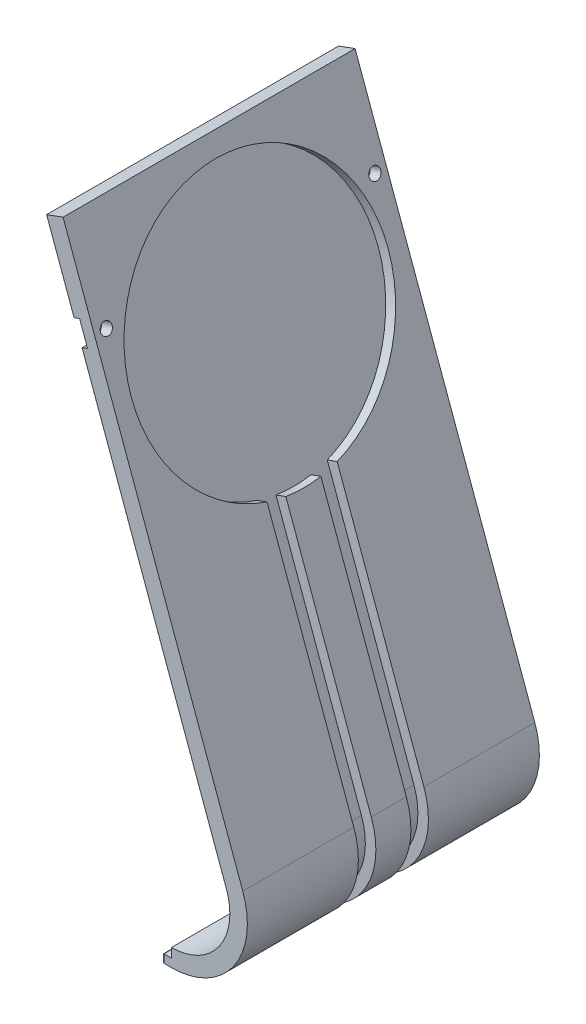
from build123d import *

# Parameters (mm, degrees)
EXTRUDE_1_DEPTH        = 25
SKETCH_4_R             = 22
CUT_EXTRUDE_1_DEPTH    = 1.8
CUT_EXTRUDE_START      = 6
CUT_EXTRUDE_1_2_DEPTH  = 3
SKETCH_11_W            = 18.9
SKETCH_11_H            = 1.4
EXTRUDE_3_DEPTH        = 1.5
FILLET_1_R             = 0.25
SKETCH_12_R            = 1
CUT_EXTRUDE_2553_DEPTH = 98.528806296
CUT_EXTRUDE_1_3_DEPTH  = 1


with BuildPart() as part:
    # 草图2 → 整体拉伸-薄壁1 (new, symmetric)
    with BuildSketch(Plane.XY):
        with BuildLine():
            ThreePointArc((28.874192719, 4.049687275), (37.065713162, 8.313922912), (38.271118927, 17.469888708))
            Line((38.271118927, 17.469888708), (7.496652644, 102.022039918))
            Line((7.496652644, 102.022039918), (10.315730506, 103.048100348))
            Line((10.315730506, 103.048100348), (41.090196789, 18.495949138))
            ThreePointArc((41.090196789, 18.495949138), (39.523169295, 6.593193603), (28.874192719, 1.049687275))
            Line((28.874192719, 1.049687275), (28.874192719, 4.049687275))
        make_face()
    extrude(amount=EXTRUDE_1_DEPTH, both=True)

    # 草图4 → Cut-Extrude 1 (cut)
    with BuildSketch(Plane(origin=(42.228040321, 15.369749728, 0), x_dir=(0, 0, -1), z_dir=(0.9396926207859071, 0.3420201433256726, 0))):
        with Locations((0, 67.905351857)):
            Circle(SKETCH_4_R)
    extrude(amount=-CUT_EXTRUDE_1_DEPTH, mode=Mode.SUBTRACT)

    # 草图3 → Cut-Extrude 1 2 (cut)
    with BuildSketch(Plane.XY.offset(CUT_EXTRUDE_START)):
        with BuildLine():
            ThreePointArc((28.874192719, 2.849687275), (38.048695615, 7.625631188), (39.398750072, 17.88031288))
            Line((39.398750072, 17.88031288), (24.836038582, 57.891033865))
            Line((24.836038582, 57.891033865), (23.809978152, 60.710111727))
            Line((23.809978152, 60.710111727), (25.50142487, 61.325747985))
            Line((25.50142487, 61.325747985), (26.5274853, 58.506670123))
            Line((26.5274853, 58.506670123), (41.090196789, 18.495949138))
            ThreePointArc((41.090196789, 18.495949138), (39.523169295, 6.593193603), (28.874192719, 1.049687275))
            Line((28.874192719, 1.049687275), (28.874192719, 2.849687275))
        make_face()
    cut_extrude_1_2 = extrude(amount=-CUT_EXTRUDE_1_2_DEPTH, mode=Mode.SUBTRACT)

    # 镜向1: Cut-Extrude 1 2 across plane
    add(cut_extrude_1_2.mirror(Plane.XY), mode=Mode.SUBTRACT)

    # 草图11 → 底部卡扣凸台-拉伸3 (add)
    with BuildSketch(Plane.ZY.offset(-28.874192719)):
        with Locations((-15.55, 1.749687275)):
            Rectangle(SKETCH_11_W, SKETCH_11_H)
        with Locations((15.55, 1.749687275)):
            Rectangle(SKETCH_11_W, SKETCH_11_H)
    extrude(amount=EXTRUDE_3_DEPTH)

    # 底部卡扣圆角1
    fillet_1_edges = [part.edges().sort_by_distance(p)[0] for p in [
        (27.374192719, 2.449687275, 15.55),
        (27.374192719, 1.749687275, 25),
        (27.374192719, 1.049687275, 15.55),
        (27.374192719, 1.749687275, 6.1),
        (27.374192719, 2.449687275, -15.55),
        (27.374192719, 1.749687275, -6.1),
        (27.374192719, 1.049687275, -15.55),
        (27.374192719, 1.749687275, -25),
    ]]
    fillet(fillet_1_edges, radius=FILLET_1_R)

    # 草图12 → Cut-Extrude 2553 (cut, through all)
    with BuildSketch(Plane(origin=(39.408962459, 14.343689298, 0), x_dir=(0, 0, 1), z_dir=(-0.9396926207859071, -0.3420201433256726, 0))):
        with Locations((23, 77.543148311)):
            Circle(SKETCH_12_R)
        with Locations((-23, 77.543148311)):
            Circle(SKETCH_12_R)
    extrude(amount=-CUT_EXTRUDE_2553_DEPTH, mode=Mode.SUBTRACT)

    # 草图13 → Cut-Extrude 1 3 (cut)
    with BuildSketch(Plane(origin=(39.408962459, 14.343689298, 0), x_dir=(0, 0, 1), z_dir=(-0.9396926207859071, -0.3420201433256726, 0))):
        with BuildLine():
            Line((23, 79.543148311), (25, 79.543148311))
            Line((25, 79.543148311), (25, 75.543148311))
            Line((25, 75.543148311), (23, 75.543148311))
            ThreePointArc((23, 75.543148311), (21, 77.543148311), (23, 79.543148311))
        make_face()
        with BuildLine():
            Line((-25, 79.543148311), (-25, 75.543148311))
            Line((-25, 75.543148311), (-23, 75.543148311))
            ThreePointArc((-23, 75.543148311), (-21, 77.543148311), (-23, 79.543148311))
            Line((-23, 79.543148311), (-25, 79.543148311))
        make_face()
    extrude(amount=-CUT_EXTRUDE_1_3_DEPTH, mode=Mode.SUBTRACT)


solid = part.part
